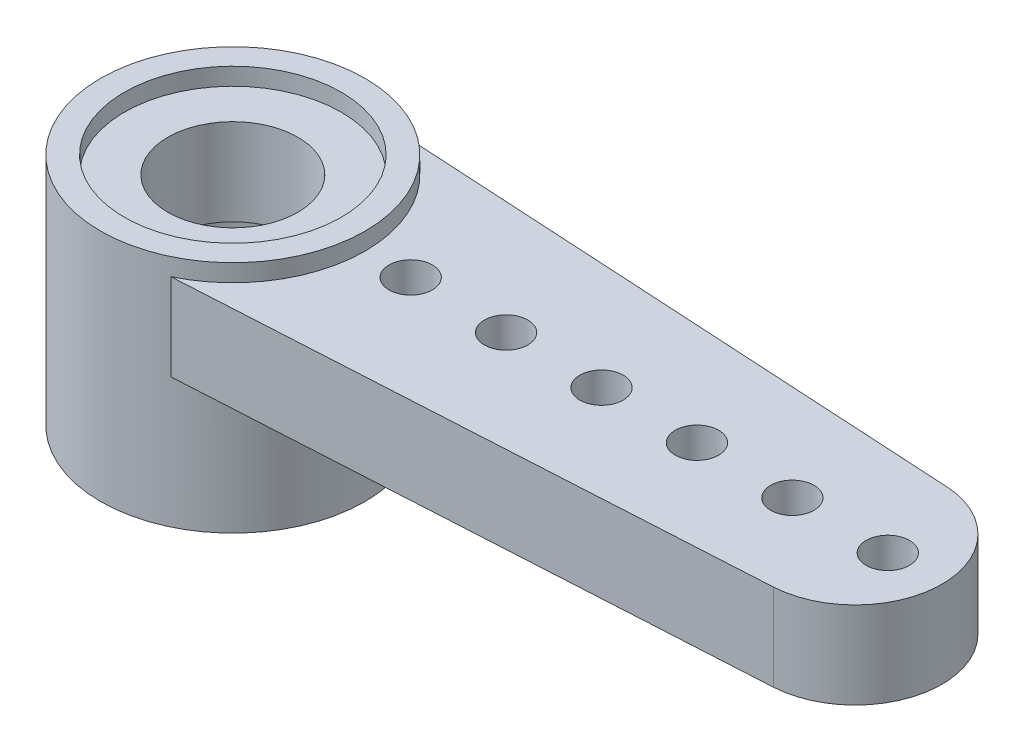
from build123d import *

# Parameters (mm, degrees)
SKETCH1_R           = 3.05
SKETCH1_R_2         = 2.5
BOSS_EXTRUDE1_DEPTH = 5.4
BOSS_EXTRUDE2_DEPTH = 2
CUT_EXTRUDE1_REACH  = 19.367
SKETCH3_R           = 0.5
CUT_EXTRUDE3_REACH  = 19.367
SKETCH6_R           = 1.5


with BuildPart() as part:
    # Sketch1 → Boss-Extrude1 (new body)
    with BuildSketch(Plane(origin=(0, 0, 0), x_dir=(1, 0, 0), z_dir=(0, 1, 0))):
        Circle(SKETCH1_R)
        Circle(SKETCH1_R_2, mode=Mode.SUBTRACT)
    extrude(amount=BOSS_EXTRUDE1_DEPTH)

    # Sketch2 → Boss-Extrude2 (add)
    with BuildSketch(Plane(origin=(0, 3, 0), x_dir=(1, 0, 0), z_dir=(0, 1, 0))):
        with BuildLine():
            Line((1.319090596, 2.75), (14.460885343, 2))
            ThreePointArc((14.460885343, 2), (16.35, 0), (14.460885343, -2))
            Line((14.460885343, -2), (1.319090596, -2.75))
            ThreePointArc((1.319090596, -2.75), (-3.05, 0), (1.319090596, 2.75))
        make_face()
    extrude(amount=BOSS_EXTRUDE2_DEPTH)

    # Sketch3 → Cut-Extrude1 (cut, up to next)
    with BuildSketch(Plane(origin=(0, 5, 0), x_dir=(1, 0, 0), z_dir=(0, 1, 0)), mode=Mode.PRIVATE) as cut_extrude1_sk1:
        with Locations((4.1, 0)):
            Circle(SKETCH3_R)
    cut_extrude1_tool1 = extrude(cut_extrude1_sk1.sketch, amount=-CUT_EXTRUDE1_REACH, mode=Mode.PRIVATE) & part.part
    # Sketch3 → Cut-Extrude1 (cut, up to next)
    with BuildSketch(Plane(origin=(0, 5, 0), x_dir=(1, 0, 0), z_dir=(0, 1, 0)), mode=Mode.PRIVATE) as cut_extrude1_sk2:
        with Locations((6.3, 0)):
            Circle(SKETCH3_R)
    cut_extrude1_tool2 = extrude(cut_extrude1_sk2.sketch, amount=-CUT_EXTRUDE1_REACH, mode=Mode.PRIVATE) & part.part
    # Sketch3 → Cut-Extrude1 (cut, up to next)
    with BuildSketch(Plane(origin=(0, 5, 0), x_dir=(1, 0, 0), z_dir=(0, 1, 0)), mode=Mode.PRIVATE) as cut_extrude1_sk3:
        with Locations((8.5, 0)):
            Circle(SKETCH3_R)
    cut_extrude1_tool3 = extrude(cut_extrude1_sk3.sketch, amount=-CUT_EXTRUDE1_REACH, mode=Mode.PRIVATE) & part.part
    # Sketch3 → Cut-Extrude1 (cut, up to next)
    with BuildSketch(Plane(origin=(0, 5, 0), x_dir=(1, 0, 0), z_dir=(0, 1, 0)), mode=Mode.PRIVATE) as cut_extrude1_sk4:
        with Locations((10.7, 0)):
            Circle(SKETCH3_R)
    cut_extrude1_tool4 = extrude(cut_extrude1_sk4.sketch, amount=-CUT_EXTRUDE1_REACH, mode=Mode.PRIVATE) & part.part
    # Sketch3 → Cut-Extrude1 (cut, up to next)
    with BuildSketch(Plane(origin=(0, 5, 0), x_dir=(1, 0, 0), z_dir=(0, 1, 0)), mode=Mode.PRIVATE) as cut_extrude1_sk5:
        with Locations((12.9, 0)):
            Circle(SKETCH3_R)
    cut_extrude1_tool5 = extrude(cut_extrude1_sk5.sketch, amount=-CUT_EXTRUDE1_REACH, mode=Mode.PRIVATE) & part.part
    # Sketch3 → Cut-Extrude1 (cut, up to next)
    with BuildSketch(Plane(origin=(0, 5, 0), x_dir=(1, 0, 0), z_dir=(0, 1, 0)), mode=Mode.PRIVATE) as cut_extrude1_sk6:
        with Locations((15.1, 0)):
            Circle(SKETCH3_R)
    cut_extrude1_tool6 = extrude(cut_extrude1_sk6.sketch, amount=-CUT_EXTRUDE1_REACH, mode=Mode.PRIVATE) & part.part
    add(cut_extrude1_tool1.solids().sort_by_distance((4.1, 5, 0))[0], mode=Mode.SUBTRACT)
    add(cut_extrude1_tool2.solids().sort_by_distance((6.3, 5, 0))[0], mode=Mode.SUBTRACT)
    add(cut_extrude1_tool3.solids().sort_by_distance((8.5, 5, 0))[0], mode=Mode.SUBTRACT)
    add(cut_extrude1_tool4.solids().sort_by_distance((10.7, 5, 0))[0], mode=Mode.SUBTRACT)
    add(cut_extrude1_tool5.solids().sort_by_distance((12.9, 5, 0))[0], mode=Mode.SUBTRACT)
    add(cut_extrude1_tool6.solids().sort_by_distance((15.1, 5, 0))[0], mode=Mode.SUBTRACT)

    # Sketch6 → Cut-Extrude3 (cut, up to next)
    with BuildSketch(Plane(origin=(0, 5, 0), x_dir=(1, 0, 0), z_dir=(0, 1, 0)), mode=Mode.PRIVATE) as cut_extrude3_sk1:
        Circle(SKETCH6_R)
    cut_extrude3_tool1 = extrude(cut_extrude3_sk1.sketch, amount=-CUT_EXTRUDE3_REACH, mode=Mode.PRIVATE) & part.part
    add(cut_extrude3_tool1.solids().sort_by_distance((0, 5, 0))[0], mode=Mode.SUBTRACT)


solid = part.part
